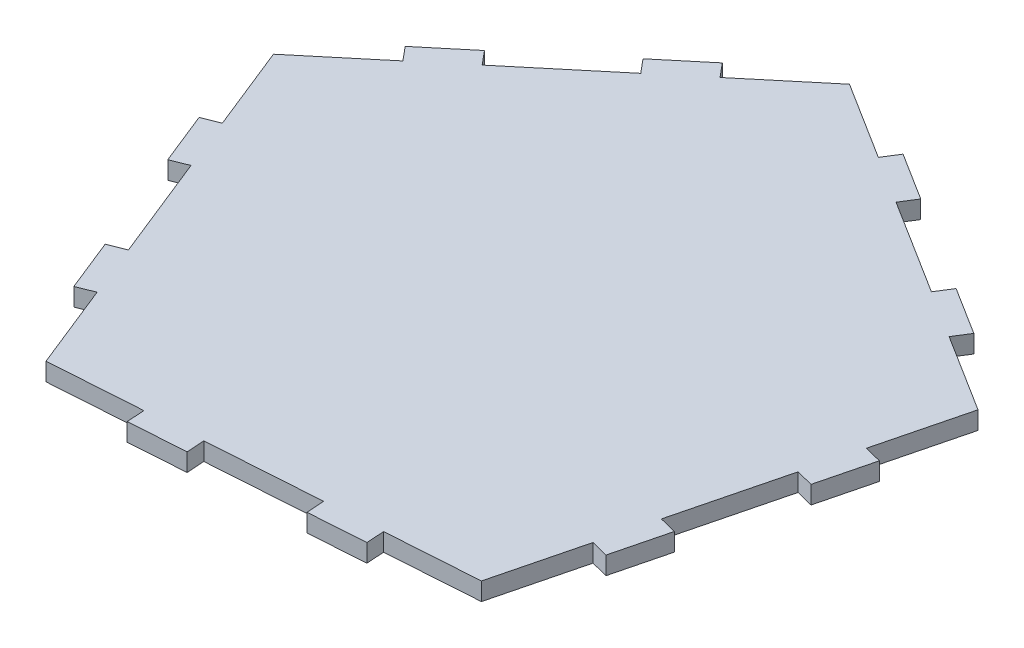
from build123d import *

# Parameters (mm, degrees)
BOSS_EXTRUDE1_DEPTH = 3.18
CUT_EXTRUDE2_DEPTH  = 10
CIRPATTERN2_COUNT   = 5


with BuildPart() as part:
    # Sketch1 → Boss-Extrude1 (new body)
    with BuildSketch(Plane(origin=(0, 0, 0), x_dir=(1, 0, 0), z_dir=(0, 1, 0))):
        Polygon((-63.737105075, 16.079573621), (-34.988431912, -55.6487276), (42.113064941, -50.472378708), (61.015737415, 24.455082065), (-4.403265369, 65.586450623), align=None)
    extrude(amount=BOSS_EXTRUDE1_DEPTH)

    # Sketch3 → Cut-Extrude2 (cut)
    with BuildSketch(Plane.XZ):
        Polygon((-53.851635285, 0.037109433), (-56.803376613, 1.220166124), (-63.737105075, -16.079573621), (-61.169762168, -18.221709207), align=None)
        Polygon((-53.083072553, 10.502371557), (-50.131331225, 9.319314866), (-42.690723106, 27.883725732), (-45.642464434, 29.066782423), align=None)
        Polygon((-34.988431912, 55.6487276), (-41.922160374, 38.348987856), (-38.970419046, 37.165931165), (-31.652292163, 55.424749805), align=None)
    cut_extrude2 = extrude(amount=-CUT_EXTRUDE2_DEPTH, mode=Mode.SUBTRACT)

    # CirPattern2: Cut-Extrude2 ×5 about axis
    cirpattern2_axis = Axis((0, 3.339, 0), (0, -1, 0))
    for i in range(1, CIRPATTERN2_COUNT):
        add(cut_extrude2.rotate(cirpattern2_axis, i * 360 / CIRPATTERN2_COUNT), mode=Mode.SUBTRACT)


solid = part.part
